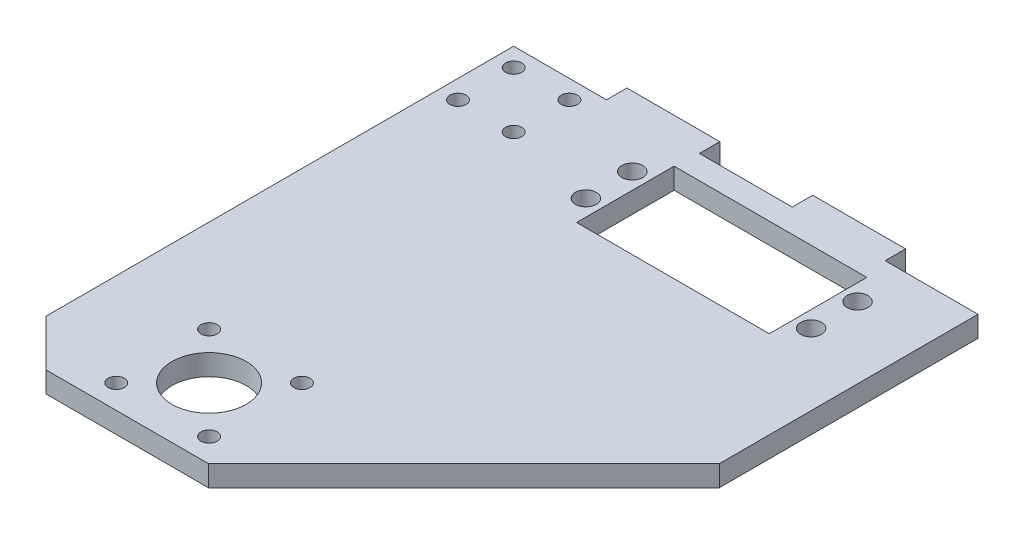
from build123d import *

# Parameters (mm, degrees)
SKETCH2_W           = 220
SKETCH2_H           = 140
BOSS_EXTRUDE1_DEPTH = 4.5
SKETCH3_R           = 8
CUT_EXTRUDE1_DEPTH  = 131.461680198
SKETCH4_W           = 20
SKETCH4_H           = 4.4
TEETH_CUT_DEPTH     = 131.461680198
TRIM_CUT_DEPTH      = 131.461680198
SKETCH6_R           = 2.25
SKETCH6_R_2         = 1.75
SKETCH6_W           = 41.5
SKETCH6_H           = 21
CUT_EXTRUDE2_DEPTH  = 100.097174531
CHAMFER4_SIZE       = 10
CHAMFER5_SIZE       = 55


with BuildPart() as part:
    # Sketch2 → Boss-Extrude1 (new body)
    with BuildSketch(Plane(origin=(0, 0, 0), x_dir=(1, 0, 0), z_dir=(0, 1, 0))):
        Rectangle(SKETCH2_W, SKETCH2_H)
    extrude(amount=BOSS_EXTRUDE1_DEPTH)

    # Sketch3 → Cut-Extrude1 (cut, through all)
    with BuildSketch(Plane(origin=(0, 4.5, 0), x_dir=(1, 0, 0), z_dir=(0, 1, 0))):
        with Locations((0, -30)):
            Circle(SKETCH3_R)
        with Locations((40.6, 50)):
            Circle(SKETCH3_R)
    extrude(amount=-CUT_EXTRUDE1_DEPTH, mode=Mode.SUBTRACT)

    # Sketch4 → Teeth cut (cut, through all)
    with BuildSketch(Plane.XZ):
        with Locations((100, -67.8)):
            Rectangle(SKETCH4_W, SKETCH4_H)
        with Locations((60, -67.8)):
            Rectangle(SKETCH4_W, SKETCH4_H)
        with Locations((20, -67.8)):
            Rectangle(SKETCH4_W, SKETCH4_H)
        with Locations((-20, -67.8)):
            Rectangle(SKETCH4_W, SKETCH4_H)
        with Locations((-60, -67.8)):
            Rectangle(SKETCH4_W, SKETCH4_H)
        with Locations((-100, -67.8)):
            Rectangle(SKETCH4_W, SKETCH4_H)
    extrude(amount=-TEETH_CUT_DEPTH, mode=Mode.SUBTRACT)

    # Sketch5 → Trim cut (cut, through all)
    with BuildSketch(Plane.XZ):
        Polygon((110, -70.1), (70, -70.1), (70, 45.124241674), (-30, 45.124241674), (-30, -70.1), (-110, -70.1), (-110, 70), (-30, 70), (70, 70), (110, 70), align=None)
    extrude(amount=-TRIM_CUT_DEPTH, mode=Mode.SUBTRACT)

    # Sketch6 → Cut-Extrude2 (cut, through all)
    with BuildSketch(Plane(origin=(0, 4.5, 0), x_dir=(1, 0, 0), z_dir=(0, 1, 0))):
        with Locations((6.15, 55)):
            Circle(SKETCH6_R)
        with Locations((6.15, 45)):
            Circle(SKETCH6_R)
        with Locations((54.65, 45)):
            Circle(SKETCH6_R)
        with Locations((54.65, 55)):
            Circle(SKETCH6_R)
        with Locations((-14, 49.6)):
            Circle(SKETCH6_R_2)
        with Locations((10, -20)):
            Circle(SKETCH6_R_2)
        with Locations((10, -40)):
            Circle(SKETCH6_R_2)
        with Locations((-10, -40)):
            Circle(SKETCH6_R_2)
        with Locations((-10, -20)):
            Circle(SKETCH6_R_2)
        with Locations((-26, 49.6)):
            Circle(SKETCH6_R_2)
        with Locations((-26, 61.6)):
            Circle(SKETCH6_R_2)
        with Locations((-14, 61.6)):
            Circle(SKETCH6_R_2)
        with Locations((30.4, 50)):
            Rectangle(SKETCH6_W, SKETCH6_H)
    extrude(amount=-CUT_EXTRUDE2_DEPTH, mode=Mode.SUBTRACT)

    # Chamfer4
    chamfer4_edges = [part.edges().sort_by_distance(p)[0] for p in [
        (-30, 2.25, 45.124241674),
    ]]
    chamfer(chamfer4_edges, length=CHAMFER4_SIZE)

    # Chamfer5
    chamfer5_edges = [part.edges().sort_by_distance(p)[0] for p in [
        (70, 2.25, 45.124241674),
    ]]
    chamfer(chamfer5_edges, length=CHAMFER5_SIZE)


solid = part.part
